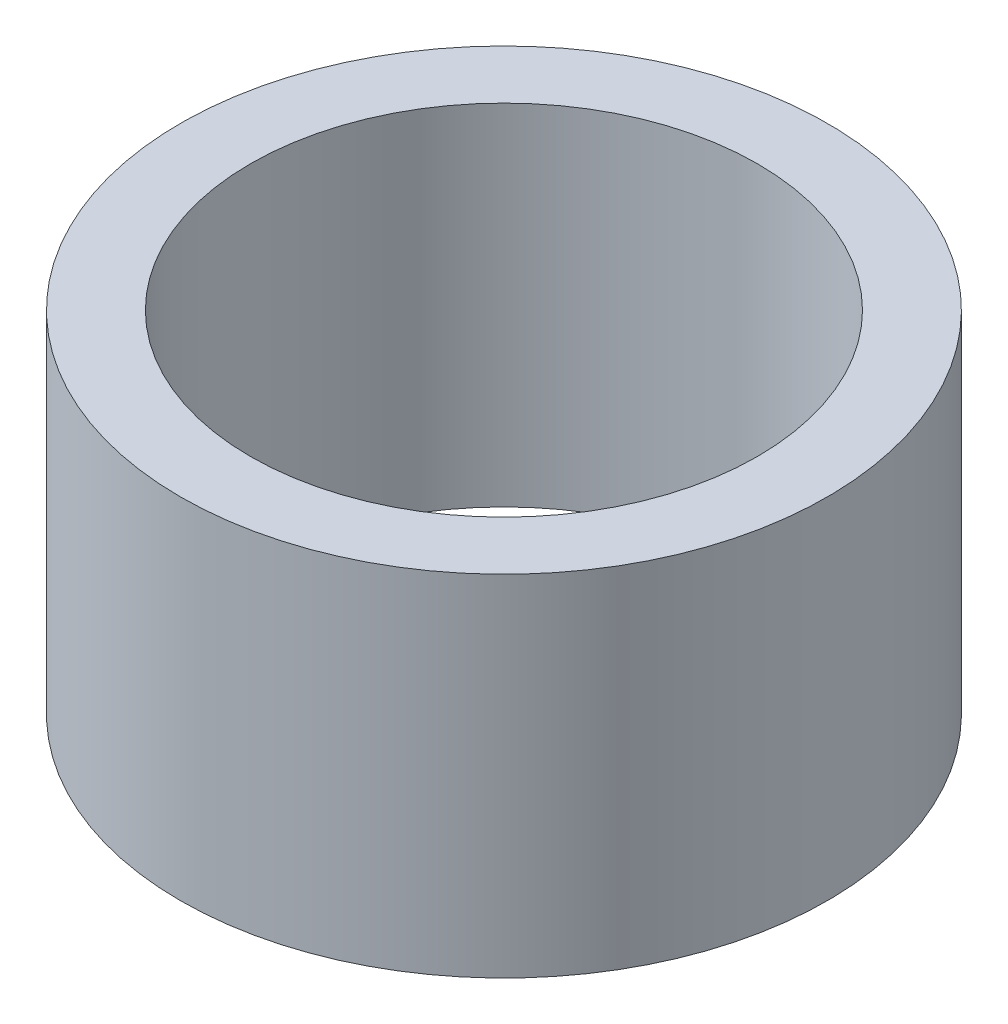
from build123d import *

# Parameters (mm, degrees)
SKETCH1_R           = 18.5
SKETCH1_R_2         = 14.5
BOSS_EXTRUDE1_DEPTH = 20


with BuildPart() as part:
    # Sketch1 → Boss-Extrude1 (new body)
    with BuildSketch(Plane(origin=(0, 0, 0), x_dir=(1, 0, 0), z_dir=(0, 1, 0))):
        Circle(SKETCH1_R)
        Circle(SKETCH1_R_2, mode=Mode.SUBTRACT)
    extrude(amount=BOSS_EXTRUDE1_DEPTH)


solid = part.part
